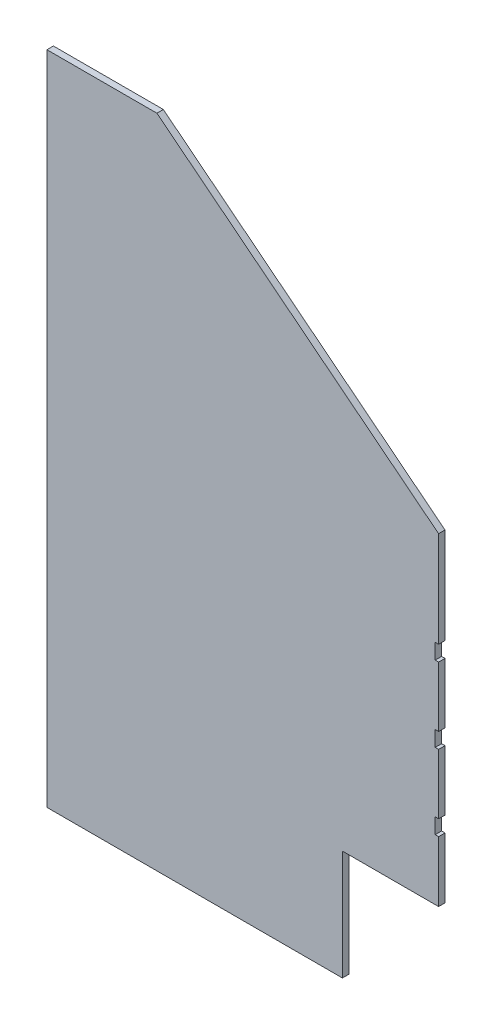
from build123d import *

# Parameters (mm, degrees)
BOSS_EXTRUDE1_DEPTH = 11.90625
SKETCH2_W           = 6.35
SKETCH2_H           = 28.575
CUT_EXTRUDE1_DEPTH  = 921.347584726


with BuildPart() as part:
    # Sketch1 → Boss-Extrude1 (new body)
    with BuildSketch(Plane.XY):
        Polygon((96.416326531, 530.160204082), (617.116326531, 117.410204082), (617.116326531, -479.489795918), (439.316326531, -479.489795918), (439.316326531, -682.689795918), (-106.783673469, -682.689795918), (-106.783673469, 530.160204082), align=None)
    extrude(amount=BOSS_EXTRUDE1_DEPTH)

    # Sketch2 → Cut-Extrude1 (cut, through all)
    with BuildSketch(Plane.XY.offset(11.90625)):
        with Locations((613.941326531, -353.251795918)):
            Rectangle(SKETCH2_W, SKETCH2_H)
        with Locations((613.941326531, -213.551795918)):
            Rectangle(SKETCH2_W, SKETCH2_H)
        with Locations((613.941326531, -73.851795918)):
            Rectangle(SKETCH2_W, SKETCH2_H)
    extrude(amount=-CUT_EXTRUDE1_DEPTH, mode=Mode.SUBTRACT)


solid = part.part
